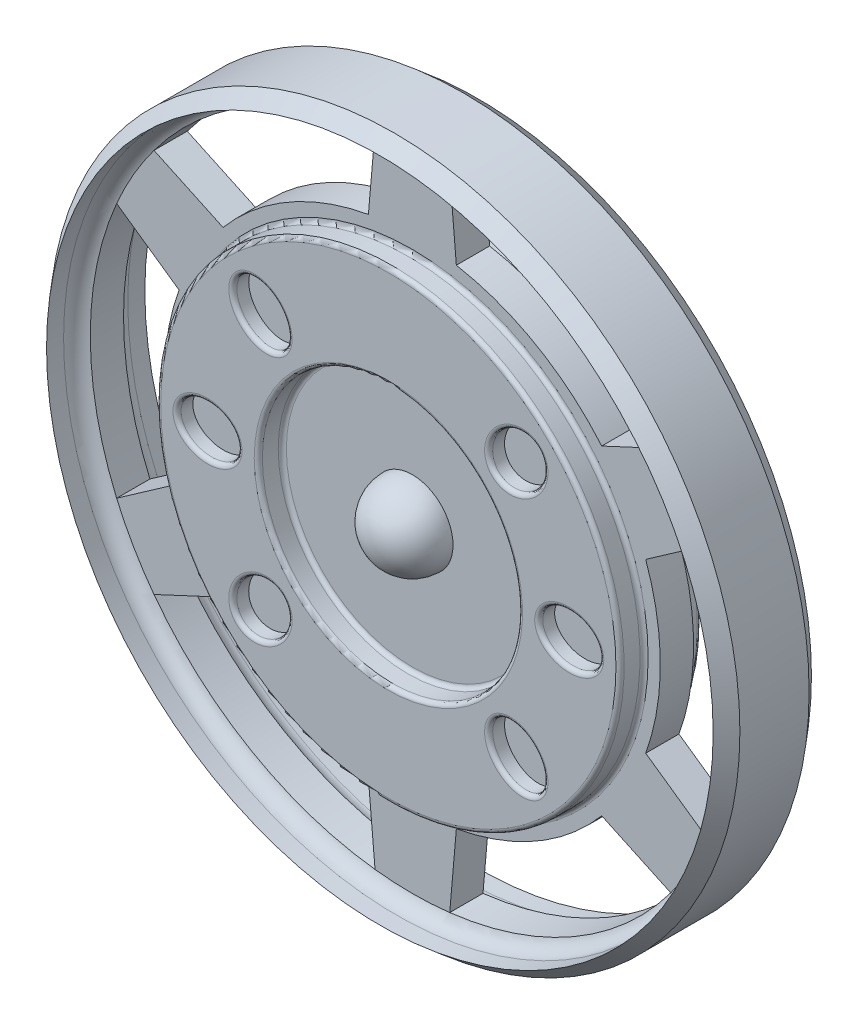
from build123d import *

# Parameters (mm, degrees)
CUT_EXTRUDE1_DEPTH       = 155.400699414
CIRPATTERN1_COUNT        = 6
SKETCH3_RX               = 9.525
SKETCH3_RY               = 7.62
CUT_EXTRUDE2_DEPTH       = 4.96475228
CIRPATTERN2_COUNT        = 8
MIRROR1_COPY_1_SKETCH_RX = 9.525
MIRROR1_COPY_1_SKETCH_RY = 7.62
MIRROR1_COPY_1_DEPTH     = 4.96475228
MIRROR1_COPY_2_SKETCH_RX = 9.525
MIRROR1_COPY_2_SKETCH_RY = 7.62
MIRROR1_COPY_2_DEPTH     = 4.96475228
MIRROR1_COPY_3_SKETCH_RX = 9.525
MIRROR1_COPY_3_SKETCH_RY = 7.62
MIRROR1_COPY_3_DEPTH     = 4.96475228
MIRROR1_COPY_4_SKETCH_RX = 9.525
MIRROR1_COPY_4_SKETCH_RY = 7.62
MIRROR1_COPY_4_DEPTH     = 4.96475228
MIRROR1_COPY_5_SKETCH_RX = 9.525
MIRROR1_COPY_5_SKETCH_RY = 7.62
MIRROR1_COPY_5_DEPTH     = 4.96475228
FILLET3_R                = 1.27
FILLET4_R                = 1.27


with BuildPart() as part:
    # Sketch1 → Revolve1 (revolve)
    with BuildSketch(Plane(origin=(0, 0, 0), x_dir=(0, 0, -1), z_dir=(1, 0, 0)), mode=Mode.PRIVATE) as revolve1_sk:
        with BuildLine():
            Line((10.814666532, 107.95), (-10.814666532, 107.95))
            Line((-10.814666532, 107.95), (-15.35524772, 104.14))
            Line((-15.35524772, 104.14), (-10.025501673, 104.14))
            ThreePointArc((-10.025501673, 104.14), (-7.041008324, 103.170863589), (-5.19524772, 100.633228129))
            Line((-5.19524772, 100.633228129), (-5.19524772, 72.39))
            Line((-5.19524772, 72.39), (-12.7, 72.39))
            Line((-12.7, 72.39), (-12.7, 40.64))
            Line((-12.7, 40.64), (-5.19524772, 40.64))
            Line((-5.19524772, 40.64), (-5.19524772, 12.7))
            ThreePointArc((-5.19524772, 12.7), (-14.175503841, 8.980256121), (-17.89524772, 0))
            Line((-17.89524772, 0), (17.89524772, 0))
            ThreePointArc((17.89524772, 0), (14.175503841, 8.980256121), (5.19524772, 12.7))
            Line((5.19524772, 12.7), (5.19524772, 40.64))
            Line((5.19524772, 40.64), (12.7, 40.64))
            Line((12.7, 40.64), (12.7, 72.39))
            Line((12.7, 72.39), (5.19524772, 72.39))
            Line((5.19524772, 72.39), (5.19524772, 100.633228129))
            ThreePointArc((5.19524772, 100.633228129), (7.041008324, 103.170863589), (10.025501673, 104.14))
            Line((10.025501673, 104.14), (15.35524772, 104.14))
            Line((15.35524772, 104.14), (10.814666532, 107.95))
        make_face()
    revolve(revolve1_sk.sketch.rotate(Axis((0, 0, 17.89524772), (0, 0, -1)), 90), axis=Axis((0, 0, 17.89524772), (0, 0, -1)))

    # Sketch2 → Cut-Extrude1 (cut, symmetric)
    with BuildSketch(Plane.XY.offset(5.19524772)):
        with BuildLine():
            Line((-92.396859492, -39.873135816), (-72.898, -26.219887414))
            ThreePointArc((-72.898, -26.219887414), (-77.47, 0), (-72.898, 26.219887414))
            Line((-72.898, 26.219887414), (-92.396859492, 39.873135816))
            ThreePointArc((-92.396859492, 39.873135816), (-100.633228129, 0), (-92.396859492, -39.873135816))
        make_face()
    cut_extrude1 = extrude(amount=CUT_EXTRUDE1_DEPTH, both=True, mode=Mode.SUBTRACT)

    # CirPattern1: Cut-Extrude1 ×6 about axis
    cirpattern1_axis = Axis((0, 0, 0), (0, 0, 1))
    for i in range(1, CIRPATTERN1_COUNT):
        add(cut_extrude1.rotate(cirpattern1_axis, i * 360 / CIRPATTERN1_COUNT), mode=Mode.SUBTRACT)

    # Sketch3 → Cut-Extrude2 (cut)
    with BuildSketch(Plane.XY.offset(12.7)):
        with Locations(Location((-39.962139739, 39.962139739), (0, 0, 135))):
            Ellipse(SKETCH3_RX, SKETCH3_RY)
    cut_extrude2 = extrude(amount=-CUT_EXTRUDE2_DEPTH, mode=Mode.SUBTRACT)

    # CirPattern2: Cut-Extrude2 ×8 about axis, 2 skipped
    cirpattern2_axis = Axis((0, 0, 5.19524772), (0, 0, 1))
    add([cut_extrude2.rotate(cirpattern2_axis, i * 360 / CIRPATTERN2_COUNT) for i in range(1, CIRPATTERN2_COUNT) if i not in (3, 7)], mode=Mode.SUBTRACT)

    # Mirror1: Cut-Extrude2 across plane
    add(cut_extrude2.mirror(Plane.XY), mode=Mode.SUBTRACT)

    # Mirror1 copy 1 sketch → Mirror1 copy 1 (cut)
    with BuildSketch(Plane(origin=(0, 0, -12.7), x_dir=(0.7071067811865476, 0.7071067811865475, 0), z_dir=(0, 0, -1))):
        with Locations(Location((-39.962139739, -39.962139739), (0, 0, -135))):
            Ellipse(MIRROR1_COPY_1_SKETCH_RX, MIRROR1_COPY_1_SKETCH_RY)
    extrude(amount=-MIRROR1_COPY_1_DEPTH, mode=Mode.SUBTRACT)

    # Mirror1 copy 2 sketch → Mirror1 copy 2 (cut)
    with BuildSketch(Plane.YX.offset(12.7)):
        with Locations(Location((-39.962139739, -39.962139739), (0, 0, -135))):
            Ellipse(MIRROR1_COPY_2_SKETCH_RX, MIRROR1_COPY_2_SKETCH_RY)
    extrude(amount=-MIRROR1_COPY_2_DEPTH, mode=Mode.SUBTRACT)

    # Mirror1 copy 3 sketch → Mirror1 copy 3 (cut)
    with BuildSketch(Plane(origin=(0, 0, -12.7), x_dir=(-1, 0, 0), z_dir=(0, 0, -1))):
        with Locations(Location((-39.962139739, -39.962139739), (0, 0, -135))):
            Ellipse(MIRROR1_COPY_3_SKETCH_RX, MIRROR1_COPY_3_SKETCH_RY)
    extrude(amount=-MIRROR1_COPY_3_DEPTH, mode=Mode.SUBTRACT)

    # Mirror1 copy 4 sketch → Mirror1 copy 4 (cut)
    with BuildSketch(Plane(origin=(0, 0, -12.7), x_dir=(-0.7071067811865477, -0.7071067811865475, 0), z_dir=(0, 0, -1))):
        with Locations(Location((-39.962139739, -39.962139739), (0, 0, -135))):
            Ellipse(MIRROR1_COPY_4_SKETCH_RX, MIRROR1_COPY_4_SKETCH_RY)
    extrude(amount=-MIRROR1_COPY_4_DEPTH, mode=Mode.SUBTRACT)

    # Mirror1 copy 5 sketch → Mirror1 copy 5 (cut)
    with BuildSketch(Plane(origin=(0, 0, -12.7), x_dir=(0, -1, 0), z_dir=(0, 0, -1))):
        with Locations(Location((-39.962139739, -39.962139739), (0, 0, -135))):
            Ellipse(MIRROR1_COPY_5_SKETCH_RX, MIRROR1_COPY_5_SKETCH_RY)
    extrude(amount=-MIRROR1_COPY_5_DEPTH, mode=Mode.SUBTRACT)

    # Fillet3
    fillet3_edges = [part.edges().sort_by_distance(p)[0] for p in [
        (-72.39, 0, 5.19524772),
        (-72.39, 0, 12.7),
        (-40.64, 0, 12.7),
        (-40.64, 0, 5.19524772),
        (-33.226104666, 33.227790795, 12.7),
        (33.227790795, 33.226104666, 12.7),
        (46.990000117, -0.001192273, 12.7),
        (33.226104666, -33.227790795, 12.7),
        (-33.227790795, -33.226104666, 12.7),
        (-46.990000117, 0.001192273, 12.7),
    ]]
    fillet(fillet3_edges, radius=FILLET3_R)

    # Fillet4
    fillet4_edges = [part.edges().sort_by_distance(p)[0] for p in [
        (-40.64, 0, -5.19524772),
        (-40.64, 0, -12.7),
        (-72.39, 0, -12.7),
        (-72.39, 0, -5.19524772),
        (33.226104666, 33.227790795, -12.7),
        (46.990000117, 0.001192273, -12.7),
        (33.227790795, -33.226104666, -12.7),
        (-33.226104666, -33.227790795, -12.7),
        (-46.990000117, -0.001192273, -12.7),
        (-33.226104666, 33.227790795, -12.7),
    ]]
    fillet(fillet4_edges, radius=FILLET4_R)


solid = part.part
